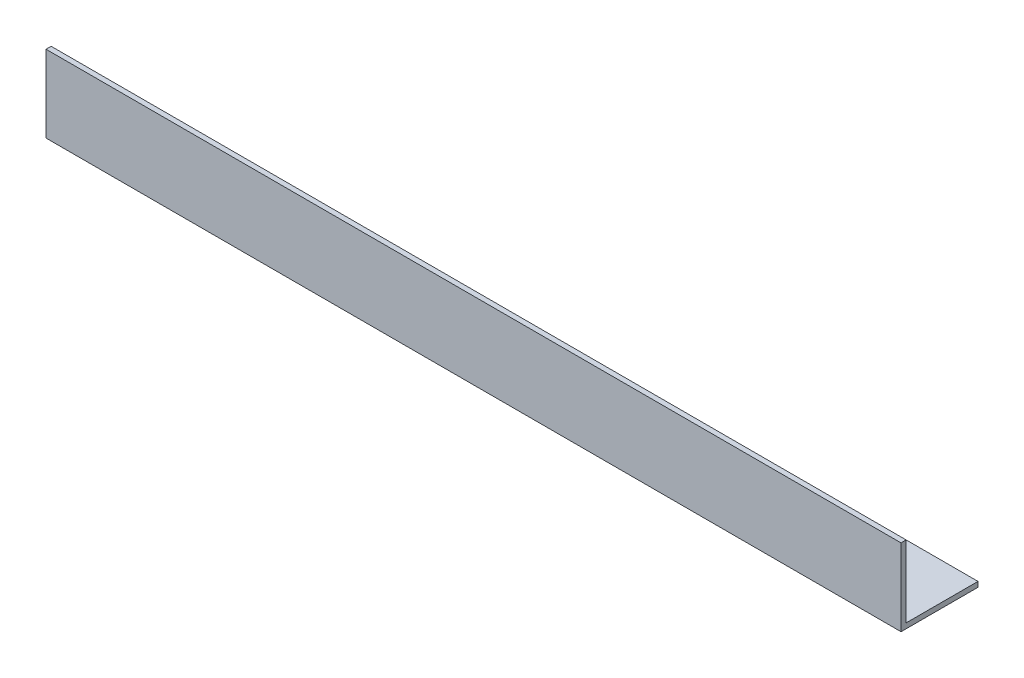
from build123d import *

# Parameters (mm, degrees)
EXTRUDE_1_DEPTH = 500


with BuildPart() as part:
    # Эскиз1 → Вытянуть-Тонкостенный1 (new body)
    with BuildSketch(Plane(origin=(0, 0, 0), x_dir=(0, 0, -1), z_dir=(1, 0, 0))):
        Polygon((45, 0), (0, 0), (0, 45), (3, 45), (3, 3), (45, 3), align=None)
    extrude(amount=EXTRUDE_1_DEPTH)


solid = part.part
